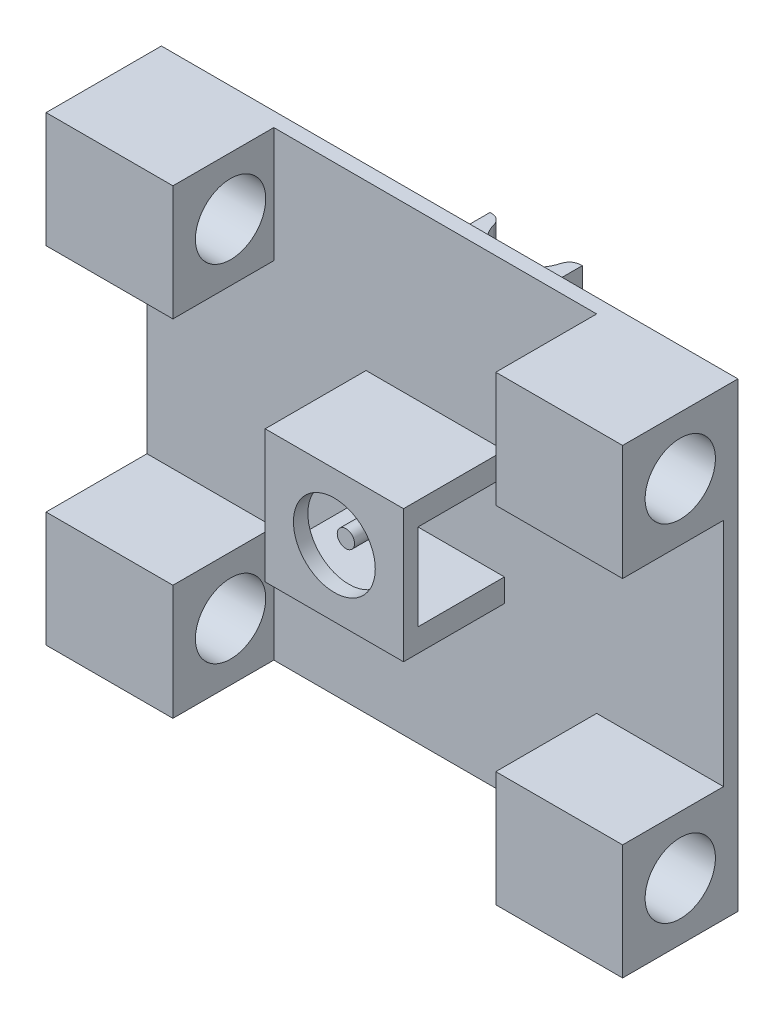
from build123d import *

# Parameters (mm, degrees)
BOSS_EXTRUDE1_DEPTH      = 10
BOSS_EXTRUDE1_DEPTH_BACK = 10
SKETCH1_W                = 100
SKETCH1_H                = 80
SKETCH2_R                = 6.1
CUT_EXTRUDE1_DEPTH       = 65.807406984
SKETCH3_W                = 15
SKETCH3_H                = 15
CUT_EXTRUDE2_DEPTH       = 241
SKETCH4_R                = 7.1
CUT_EXTRUDE3_DEPTH       = 5
SKETCH5_R                = 1.5
BOSS_EXTRUDE2_DEPTH      = 15.5
SKETCH6_W                = 21.392712436
SKETCH6_H                = 8.5
CUT_EXTRUDE4_DEPTH       = 65.807406984
SKETCH7_W                = 5
SKETCH7_H                = 20
BOSS_EXTRUDE3_DEPTH      = 25
BOSS_EXTRUDE4_START      = -15
SKETCH8_W                = 5
SKETCH8_H                = 20
BOSS_EXTRUDE4_DEPTH      = 20
FILLET4_R                = 10
FILLET5_R                = 5
CUT_EXTRUDE5_DEPTH       = 10
THREAD1_PITCH            = 0.25
SKETCH19_W               = 16
SKETCH19_H               = 7
BOSS_EXTRUDE5_DEPTH      = 15
CUT_EXTRUDE6_DEPTH       = 90
FILLET6_R                = 2
SKETCH21_W               = 56
SKETCH21_H               = 20
CUT_EXTRUDE7_DEPTH       = 17.5
SKETCH22_W               = 38
SKETCH22_H               = 23
CUT_EXTRUDE8_DEPTH       = 17.5


with BuildPart() as part:
    # Sketch1 → Boss-Extrude1 (new, two sides: drawn at the far end of the back side and taken through both)
    with BuildSketch(Plane.XY.offset(-BOSS_EXTRUDE1_DEPTH_BACK)):
        Rectangle(SKETCH1_W, SKETCH1_H)
    extrude(amount=BOSS_EXTRUDE1_DEPTH + BOSS_EXTRUDE1_DEPTH_BACK)

    # Sketch2 → Cut-Extrude1 (cut, symmetric)
    with BuildSketch(Plane(origin=(0, 0, 0), x_dir=(0, 0, -1), z_dir=(1, 0, 0))):
        with Locations(Location((0, 30, 0), (0, 0, 180))):
            Circle(SKETCH2_R)
    cut_extrude1 = extrude(amount=CUT_EXTRUDE1_DEPTH, both=True, mode=Mode.SUBTRACT)

    # Mirror1: Cut-Extrude1 across plane
    add(cut_extrude1.mirror(Plane.ZX), mode=Mode.SUBTRACT)

    # Sketch3 → Cut-Extrude2 (cut)
    with BuildSketch(Plane(origin=(50, 0, 0), x_dir=(0, 0, -1), z_dir=(1, 0, 0))):
        Rectangle(SKETCH3_W, SKETCH3_H)
    extrude(amount=-CUT_EXTRUDE2_DEPTH, mode=Mode.SUBTRACT)

    # Sketch4 → Cut-Extrude3 (cut)
    with BuildSketch(Plane.XY.offset(10)):
        Circle(SKETCH4_R)
    extrude(amount=-CUT_EXTRUDE3_DEPTH, mode=Mode.SUBTRACT)

    # Sketch5 → Boss-Extrude2 (add)
    with BuildSketch(Plane.XY.offset(-7.5)):
        with Locations(Location((0, 0, 0), (0, 0, 90))):
            Circle(SKETCH5_R)
    extrude(amount=BOSS_EXTRUDE2_DEPTH)

    # Sketch6 → Cut-Extrude4 (cut, symmetric)
    with BuildSketch(Plane(origin=(0, 0, 0), x_dir=(0, 0, -1), z_dir=(1, 0, 0))):
        with Locations((-3.196356218, 15.75)):
            Rectangle(SKETCH6_W, SKETCH6_H)
    cut_extrude4 = extrude(amount=CUT_EXTRUDE4_DEPTH, both=True, mode=Mode.SUBTRACT)

    # Mirror2: Cut-Extrude4 across plane
    add(cut_extrude4.mirror(Plane.ZX), mode=Mode.SUBTRACT)

    # Sketch7 → Boss-Extrude3 (add)
    with BuildSketch(Plane(origin=(0, 0, -10), x_dir=(-1, 0, 0), z_dir=(0, 0, -1))):
        with Locations((17.5, 0)):
            Rectangle(SKETCH7_W, SKETCH7_H)
    extrude(amount=BOSS_EXTRUDE3_DEPTH)

    # Sketch8 → Boss-Extrude4 (add)
    with BuildSketch(Plane(origin=(0, 0, 0), x_dir=(0, 0, -1), z_dir=(1, 0, 0)).offset(BOSS_EXTRUDE4_START)):
        with Locations((32.5, 0)):
            Rectangle(SKETCH8_W, SKETCH8_H)
    extrude(amount=BOSS_EXTRUDE4_DEPTH)

    # Fillet4
    fillet4_edges = [part.edges().sort_by_distance(p)[0] for p in [
        (5, 10, -32.5),
        (5, -10, -32.5),
    ]]
    fillet(fillet4_edges, radius=FILLET4_R - 0.0001)  # a hair under: the kernel refuses the full size

    # Fillet5
    fillet5_edges = [part.edges().sort_by_distance(p)[0] for p in [
        (-20, 0, -35),
        (-15, 0, -30),
    ]]
    fillet(fillet5_edges, radius=FILLET5_R)

    # Sketch11 → Cut-Extrude5 (cut)
    with BuildSketch(Plane(origin=(0, 0, -35), x_dir=(-1, 0, 0), z_dir=(0, 0, -1))):
        with BuildLine():
            ThreePointArc((2.5, 0), (0, 2.5), (-2.5, 0))
            Line((-2.5, 0), (2.5, 0))
        make_face()
        with BuildLine():
            Line((2.5, 0), (-2.5, 0))
            ThreePointArc((-2.5, 0), (0, -2.5), (2.5, 0))
        make_face()
    extrude(amount=-CUT_EXTRUDE5_DEPTH, mode=Mode.SUBTRACT)

    # Thread1: the profile of Thread Profile2 profile screwed along a right-hand helix of 20 turns, 6 arcs to a turn; built about Z, then put on its axis
    thread1_z = Axis((0, 0, 0), (0, 0, 1))
    thread1_corners = [(2.4997, 0, -0.000173205), (2.635316469, 0, 0.078125), (2.635316469, 0, 0.109375), (2.4997, 0, 0.187673204)]
    with BuildLine(mode=Mode.PRIVATE) as thread1_profile:
        Line(thread1_corners[0], thread1_corners[1])
        Line(thread1_corners[1], thread1_corners[2])
        Line(thread1_corners[2], thread1_corners[3])
        Line(thread1_corners[3], thread1_corners[0])
    thread1_cap = Face(thread1_profile.wire())
    thread1_turn_angles = [0, 30, 60, 90, 120, 150, 180, 210, 240, 270, 300, 330, 360]
    thread1_turn_weights = [1, 0.8660254037844387, 1, 0.8660254037844387, 1, 0.8660254037844387, 1, 0.8660254037844387, 1, 0.8660254037844387, 1, 0.8660254037844387, 1]
    thread1_turn_rails = [Edge.make_bspline([Vector(p[0], p[1], 0).rotate(thread1_z, thread1_turn_angles[k]) / thread1_turn_weights[k] + Vector(0, 0, p[2] + THREAD1_PITCH * thread1_turn_angles[k] / 360) for k in range(13)], [0, 0, 0, 1, 1, 2, 2, 3, 3, 4, 4, 5, 5, 6, 6, 6], 2, thread1_turn_weights) for p in thread1_corners]
    thread1_turn_sides = [Face.make_surface_from_curves(thread1_turn_rails[p[0]], thread1_turn_rails[p[1]]) for p in [(0, 1), (1, 2), (2, 3), (3, 0)]]
    thread1 = Plane(origin=(0, 0, -35), x_dir=(1, 0, 0), z_dir=(0, 0, 1)) * Solid(Shell([*[p.moved(Location((0, 0, THREAD1_PITCH * i))) for i in range(20) for p in thread1_turn_sides], thread1_cap, thread1_cap.rotate(thread1_z, 7200).moved(Location((0, 0, THREAD1_PITCH * 7200 / 360)))]))
    add(thread1, mode=Mode.SUBTRACT)

    # Sketch19 → Boss-Extrude5 (add)
    with BuildSketch(Plane(origin=(0, 0, -10), x_dir=(-1, 0, 0), z_dir=(0, 0, -1))):
        with Locations((0, 25)):
            Rectangle(SKETCH19_W, SKETCH19_H)
        with Locations((0, -25)):
            Rectangle(SKETCH19_W, SKETCH19_H)
    extrude(amount=BOSS_EXTRUDE5_DEPTH)

    # Sketch20 → Cut-Extrude6 (cut)
    with BuildSketch(Plane.XZ.offset(28.5)):
        with BuildLine():
            Line((-6, -25), (6, -25))
            ThreePointArc((6, -25), (0, -19), (-6, -25))
        make_face()
    extrude(amount=-CUT_EXTRUDE6_DEPTH, mode=Mode.SUBTRACT)

    # Fillet6
    fillet6_edges = [part.edges().sort_by_distance(p)[0] for p in [
        (-6, -25, -25),
        (6, -25, -25),
        (6, 25, -25),
        (-6, 25, -25),
    ]]
    fillet(fillet6_edges, radius=FILLET6_R)

    # Sketch21 → Cut-Extrude7 (cut)
    with BuildSketch(Plane.XY.offset(10)):
        with Locations((0, 30)):
            Rectangle(SKETCH21_W, SKETCH21_H)
        with Locations((0, -30)):
            Rectangle(SKETCH21_W, SKETCH21_H)
    extrude(amount=-CUT_EXTRUDE7_DEPTH, mode=Mode.SUBTRACT)

    # Sketch22 → Cut-Extrude8 (cut)
    with BuildSketch(Plane.XY.offset(10)):
        with Locations((-31, 0)):
            Rectangle(SKETCH22_W, SKETCH22_H)
        with Locations((31, 0)):
            Rectangle(SKETCH22_W, SKETCH22_H)
    extrude(amount=-CUT_EXTRUDE8_DEPTH, mode=Mode.SUBTRACT)


solid = part.part
